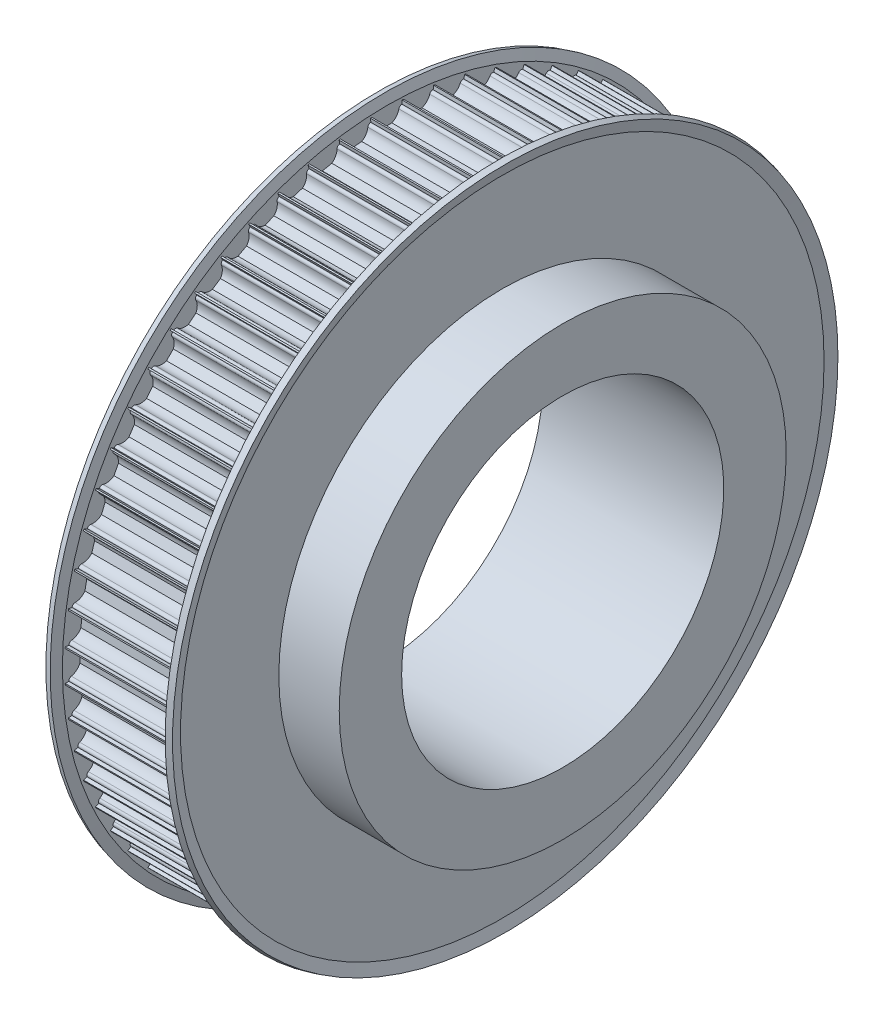
from build123d import *

# Parameters (mm, degrees)
CUT_EXTRUDE1_DEPTH = 122.757956619
CIRPATTERN1_COUNT  = 64


with BuildPart() as part:
    # Sketch2 → Revolve1 (revolve)
    with BuildSketch(Plane.XY, mode=Mode.PRIVATE) as revolve1_sk:
        Polygon((0, 40), (0, 80), (30, 80), (30, 55.5), (45, 55.5), (45, 40), align=None)
    revolve(revolve1_sk.sketch.rotate(Axis((0, 0, 0), (1, 0, 0)), 90), axis=Axis((0, 0, 0), (1, 0, 0)))

    # Sketch3 → Cut-Extrude1 (cut, through all)
    with BuildSketch(Plane.ZY):
        with BuildLine():
            Line((-3.674234614, 79), (-3.75, 79))
            Line((-3.75, 79), (-3.75, 81))
            Line((-3.75, 81), (3.75, 81))
            Line((3.75, 81), (3.75, 79))
            Line((3.75, 79), (3.674234614, 79))
            ThreePointArc((3.674234614, 79), (3.199892965, 78.830947502), (2.939387691, 78.4))
            ThreePointArc((2.939387691, 78.4), (2.331759211, 77.112435701), (1.198957881, 76.25))
            Line((1.198957881, 76.25), (-1.198957881, 76.25))
            ThreePointArc((-1.198957881, 76.25), (-2.331759211, 77.112435701), (-2.939387691, 78.4))
            ThreePointArc((-2.939387691, 78.4), (-3.199892965, 78.830947502), (-3.674234614, 79))
        make_face()
    cut_extrude1 = extrude(amount=-CUT_EXTRUDE1_DEPTH, mode=Mode.SUBTRACT)

    # CirPattern1: Cut-Extrude1 ×64 about axis
    cirpattern1_axis = Axis((0, 0, 0), (1, 0, 0))
    for i in range(1, CIRPATTERN1_COUNT):
        add(cut_extrude1.rotate(cirpattern1_axis, i * 360 / CIRPATTERN1_COUNT), mode=Mode.SUBTRACT)

    # Sketch4 → Revolve2 (revolve)
    with BuildSketch(Plane.XY, mode=Mode.PRIVATE) as revolve2_sk:
        Polygon((30, 55.5), (28.634691844, 55.5), (28.634691844, 80.61), (29.277769905, 83.01), (30.726658645, 82.621771432), (30, 79.90984445), align=None)
        Polygon((0, 55.5), (1.365308156, 55.5), (1.365308156, 80.61), (0.722230095, 83.01), (-0.726658645, 82.621771432), (0, 79.90984445), align=None)
    revolve(revolve2_sk.sketch.rotate(Axis((0, 0, 0), (-1, 0, 0)), 90), axis=Axis((0, 0, 0), (-1, 0, 0)))


solid = part.part
